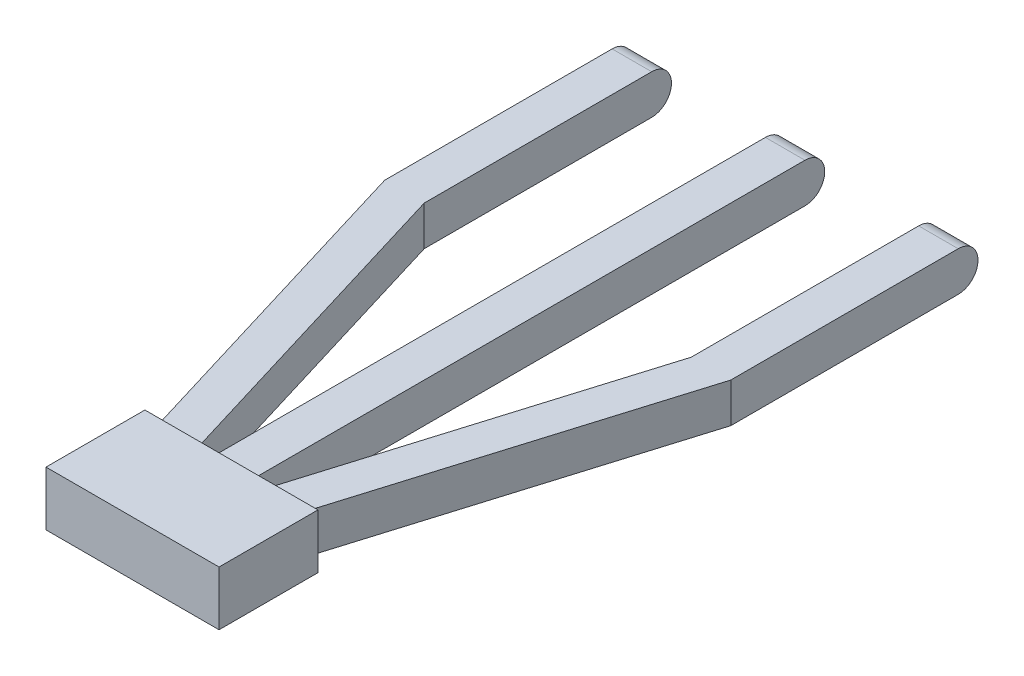
from build123d import *

# Parameters (mm, degrees)
SKETCH1_W             = 0.8
SKETCH1_H             = 0.8
BOSS_EXTRUDE1_DEPTH   = 13.6
SKETCH2_R             = 0.05
BOSS_EXTRUDE2_DEPTH   = 1
SKETCH3_W             = 3.5
SKETCH3_H             = 1.1
SKETCH3_W_2           = 0.8
SKETCH3_H_2           = 0.8
BOSS_EXTRUDE3_DEPTH   = 2
SKETCH6_W             = 0.8
SKETCH6_H             = 0.8
BOSS_EXTRUDE4_DEPTH   = 5
BOSS_EXTRUDE4_2_DEPTH = 5
SKETCH8_R             = 0.05
BOSS_EXTRUDE5_DEPTH   = 1
SKETCH9_R             = 0.05
BOSS_EXTRUDE6_DEPTH   = 1
LOFT1_START           = -0.4
LOFT1_DEPTH           = 0.8
LOFT2_START           = -0.4
LOFT2_DEPTH           = 0.8
FILLET1_R             = 0.4


# Read off the part's stored shape, not the designer's step: Loft1, Loft2
with BuildPart() as part:
    # Sketch1 → Boss-Extrude1 (new body)
    with BuildSketch(Plane.XY):
        Rectangle(SKETCH1_W, SKETCH1_H)
    extrude(amount=BOSS_EXTRUDE1_DEPTH)

    # Sketch2 → Boss-Extrude2 (add)
    with BuildSketch(Plane(origin=(0.4, 0, 0), x_dir=(0, 0, -1), z_dir=(1, 0, 0))):
        with Locations(Location((-0.2, -0.2, 0), (0, 0, 90))):
            Circle(SKETCH2_R)
    extrude(amount=-BOSS_EXTRUDE2_DEPTH)

    # Sketch3 → Boss-Extrude3 (add)
    # profile 1 of 3: a face of its own
    with BuildSketch(Plane.XY.offset(13.6)):
        Rectangle(SKETCH3_W, SKETCH3_H)
        Rectangle(SKETCH3_W_2, SKETCH3_H_2, mode=Mode.SUBTRACT)
    # profile 2 of 3: a face of its own
    with BuildSketch(Plane.XY.offset(13.6)):
        Rectangle(SKETCH3_W_2, SKETCH3_H_2)
    # profile 3 of 3: a face of its own
    with BuildSketch(Plane.XY.offset(13.6)):
        Rectangle(SKETCH3_W_2, SKETCH3_H_2)
    extrude(amount=-BOSS_EXTRUDE3_DEPTH)



with BuildPart() as body_2:
    # Sketch6 → Boss-Extrude4 (new body)
    with BuildSketch(Plane.XY):
        with Locations((3.1, 0)):
            Rectangle(SKETCH6_W, SKETCH6_H)
    extrude(amount=BOSS_EXTRUDE4_DEPTH)

    # Sketch8 → Boss-Extrude5 (add)
    with BuildSketch(Plane(origin=(3.5, 0, 0), x_dir=(0, 0, -1), z_dir=(1, 0, 0))):
        with Locations(Location((-0.2, -0.2, 0), (0, 0, 90))):
            Circle(SKETCH8_R)
    extrude(amount=-BOSS_EXTRUDE5_DEPTH)


with BuildPart() as body_3:
    # Sketch6 → Boss-Extrude4 2 (new body)
    with BuildSketch(Plane.XY):
        with Locations((-3.1, 0)):
            Rectangle(SKETCH6_W, SKETCH6_H)
    extrude(amount=BOSS_EXTRUDE4_2_DEPTH)

    # Sketch9 → Boss-Extrude6 (add)
    with BuildSketch(Plane(origin=(-2.7, 0, 0), x_dir=(0, 0, -1), z_dir=(1, 0, 0))):
        with Locations((-0.2, -0.2)):
            Circle(SKETCH9_R)
    extrude(amount=-BOSS_EXTRUDE6_DEPTH)


with BuildPart() as part_1:
    add(part.part)

    add(body_2.part)  # Loft1 merges body 2
    # Loft1 outline → Loft1 (add)
    with BuildSketch(Plane(origin=(0, 0, 0), x_dir=(1, 0, 0), z_dir=(0, 1.0, 2.05342141911779e-12)).offset(LOFT1_START)):
        Polygon((0.7, -11.6), (1.5, -11.6), (3.5, -5), (2.7, -5), align=None)
    extrude(amount=LOFT1_DEPTH)


    add(body_3.part)  # Loft2 merges body 3
    # Loft2 outline → Loft2 (add)
    with BuildSketch(Plane(origin=(0, 0, 0), x_dir=(1, 0, 0), z_dir=(0, 1, 0)).offset(LOFT2_START)):
        Polygon((-2.7, -5), (-3.5, -5), (-1.5, -11.6), (-0.7, -11.6), align=None)
    extrude(amount=LOFT2_DEPTH)

    # Fillet1
    fillet1_edges = [part_1.edges().sort_by_distance(p)[0] for p in [
        (-3.1, -0.4, 0),
        (-3.1, 0.4, 0),
        (3.1, -0.4, 0),
        (3.1, 0.4, 0),
        (0, -0.4, 0),
        (0, 0.4, 0),
    ]]
    fillet(fillet1_edges, radius=FILLET1_R - 0.0001)  # a hair under: the kernel refuses the full size


solid = part_1.part
